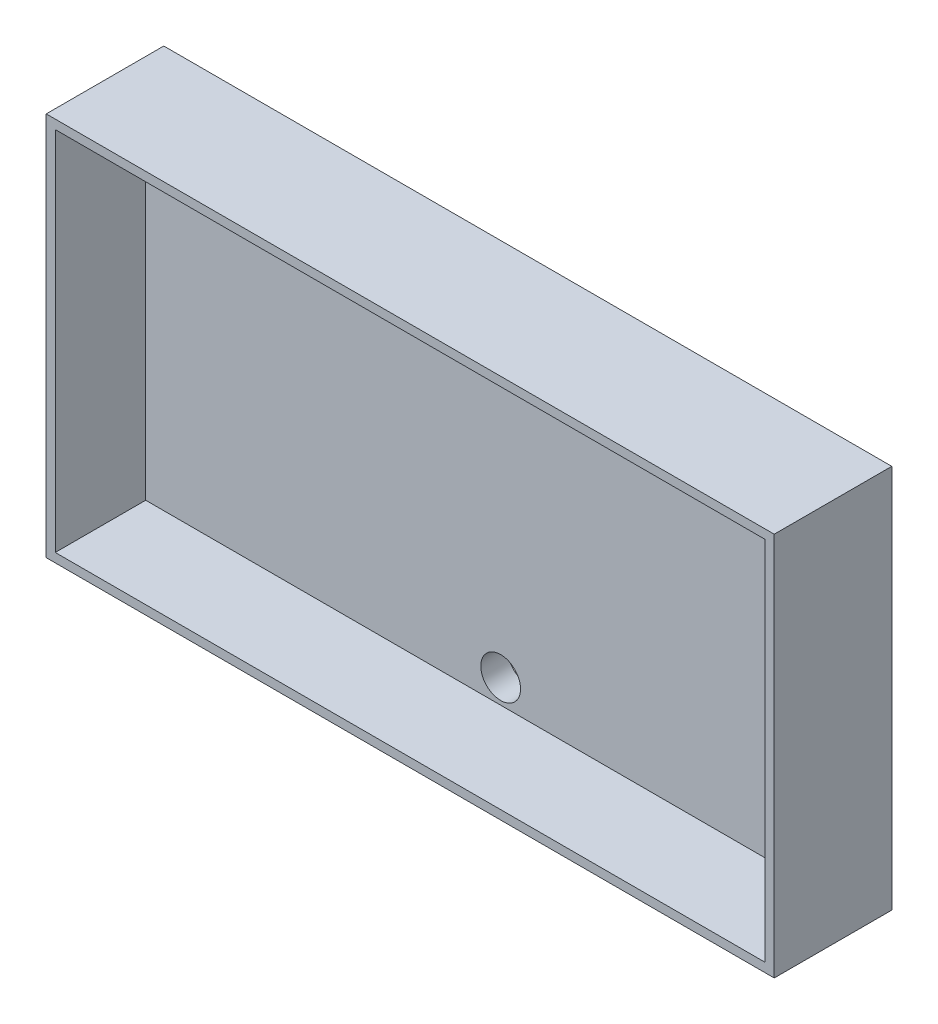
from build123d import *

# Parameters (mm, degrees)
SKETCH1_W                   = 80.5
SKETCH1_H                   = 42.5
SKETCH1_W_2                 = 78.5
SKETCH1_H_2                 = 40.5
VYSUNOUT_TENKOST_NN_1_DEPTH = 10
SKICA1_W                    = 80.5
SKICA1_H                    = 42.5
P_IDAT_VYSUNUT_M1_DEPTH     = 3
CUT_EXTRUDE2_DEPTH          = 47.60069742
CUT_EXTRUDE2_DEPTH_BACK     = 47.60069742
SKETCH3_R                   = 2.2


with BuildPart() as part:
    # Sketch1 → Vysunout tenkostěnný1 (new body)
    with BuildSketch(Plane.XY):
        Rectangle(SKETCH1_W, SKETCH1_H)
        Rectangle(SKETCH1_W_2, SKETCH1_H_2, mode=Mode.SUBTRACT)
    extrude(amount=VYSUNOUT_TENKOST_NN_1_DEPTH)

    # Skica1 → Přidat vysunutím1 (add)
    with BuildSketch(Plane.XY):
        Rectangle(SKICA1_W, SKICA1_H)
    extrude(amount=-P_IDAT_VYSUNUT_M1_DEPTH)

    # Sketch3 → Cut-Extrude2 (cut, two sides: drawn at the far end of the back side and taken through both)
    with BuildSketch(Plane.XY.offset(-CUT_EXTRUDE2_DEPTH_BACK)):
        with Locations((0, -17.6)):
            Circle(SKETCH3_R)
        with Locations((0, 17.6)):
            Circle(SKETCH3_R)
    extrude(amount=CUT_EXTRUDE2_DEPTH + CUT_EXTRUDE2_DEPTH_BACK, mode=Mode.SUBTRACT)


solid = part.part
